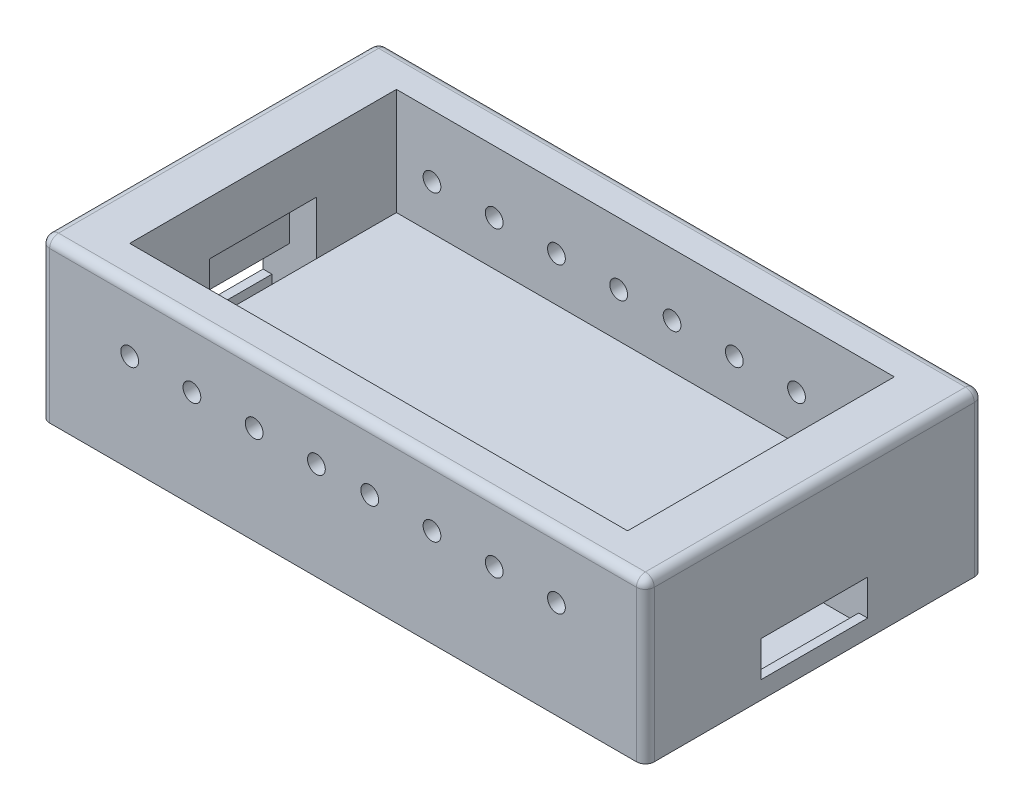
from build123d import *

# Parameters (mm, degrees)
SKETCH1_W               = 1727.2
SKETCH1_H               = 965.2
SKETCH1_W_2             = 1422.4
SKETCH1_H_2             = 762
BOSS_EXTRUDE1_DEPTH     = 457.2
SKETCH2_W               = 1422.4
SKETCH2_H               = 762
BOSS_EXTRUDE2_DEPTH     = 152.4
CUT_EXTRUDE1_DEPTH      = 1374.480192795
CUT_EXTRUDE1_DEPTH_BACK = 1374.480192795
SKETCH4_R               = 25.4
SKETCH7_W               = 304.8
SKETCH7_H               = 127
CUT_EXTRUDE2_DEPTH      = 127
SKETCH8_W               = 76.2
SKETCH8_H               = 304.8
CUT_EXTRUDE3_DEPTH      = 304.8
SKETCH9_W               = 25.4
SKETCH9_H               = 304.8
BOSS_EXTRUDE3_DEPTH     = 25.4
SKETCH11_W              = 304.8
SKETCH11_H              = 127
CUT_EXTRUDE5_DEPTH      = 127
SKETCH13_W              = 25.4
SKETCH13_H              = 304.8
BOSS_EXTRUDE4_DEPTH     = 25.4
SKETCH14_W              = 76.2
SKETCH14_H              = 304.8
CUT_EXTRUDE7_DEPTH      = 279.4
FILLET1_R               = 25.4
FILLET2_R               = 25.4


with BuildPart() as part:
    # Sketch1 → Boss-Extrude1 (new body)
    with BuildSketch(Plane(origin=(0, 0, 0), x_dir=(1, 0, 0), z_dir=(0, 1, 0))):
        Rectangle(SKETCH1_W, SKETCH1_H)
        Rectangle(SKETCH1_W_2, SKETCH1_H_2, mode=Mode.SUBTRACT)
    extrude(amount=BOSS_EXTRUDE1_DEPTH)

    # Sketch2 → Boss-Extrude2 (add)
    with BuildSketch(Plane(origin=(0, 0, 0), x_dir=(1, 0, 0), z_dir=(0, 1, 0))):
        Rectangle(SKETCH2_W, SKETCH2_H)
    extrude(amount=BOSS_EXTRUDE2_DEPTH)

    # Sketch4 → Cut-Extrude1 (cut, two sides: drawn at the far end of the back side and taken through both)
    with BuildSketch(Plane.XY.offset(482.6).offset(-CUT_EXTRUDE1_DEPTH_BACK)):
        with Locations((-609.6, 279.4)):
            Circle(SKETCH4_R)
        with Locations((-431.8, 279.4)):
            Circle(SKETCH4_R)
        with Locations((-254, 279.4)):
            Circle(SKETCH4_R)
        with Locations((-76.2, 279.4)):
            Circle(SKETCH4_R)
        with Locations((76.2, 279.4)):
            Circle(SKETCH4_R)
        with Locations((254, 279.4)):
            Circle(SKETCH4_R)
        with Locations((431.8, 279.4)):
            Circle(SKETCH4_R)
        with Locations((609.6, 279.4)):
            Circle(SKETCH4_R)
    extrude(amount=CUT_EXTRUDE1_DEPTH + CUT_EXTRUDE1_DEPTH_BACK, mode=Mode.SUBTRACT)

    # Sketch7 → Cut-Extrude2 (cut)
    with BuildSketch(Plane(origin=(863.6, 0, 0), x_dir=(0, 0, -1), z_dir=(1, 0, 0))):
        with Locations((0, 88.9)):
            Rectangle(SKETCH7_W, SKETCH7_H)
    extrude(amount=-CUT_EXTRUDE2_DEPTH, mode=Mode.SUBTRACT)

    # Sketch8 → Cut-Extrude3 (cut)
    with BuildSketch(Plane(origin=(0, 25.4, 0), x_dir=(1, 0, 0), z_dir=(0, 1, 0))):
        with Locations((749.3, 0)):
            Rectangle(SKETCH8_W, SKETCH8_H)
    extrude(amount=CUT_EXTRUDE3_DEPTH, mode=Mode.SUBTRACT)

    # Sketch9 → Boss-Extrude3 (add)
    with BuildSketch(Plane(origin=(0, 25.4, 0), x_dir=(1, 0, 0), z_dir=(0, 1, 0))):
        with Locations((850.9, 0)):
            Rectangle(SKETCH9_W, SKETCH9_H)
    extrude(amount=BOSS_EXTRUDE3_DEPTH)

    # Sketch11 → Cut-Extrude5 (cut)
    with BuildSketch(Plane.ZY.offset(863.6)):
        with Locations((0, 88.9)):
            Rectangle(SKETCH11_W, SKETCH11_H)
    extrude(amount=-CUT_EXTRUDE5_DEPTH, mode=Mode.SUBTRACT)

    # Sketch13 → Boss-Extrude4 (add)
    with BuildSketch(Plane(origin=(0, 25.4, 0), x_dir=(1, 0, 0), z_dir=(0, 1, 0))):
        with Locations((-850.9, 0)):
            Rectangle(SKETCH13_W, SKETCH13_H)
    extrude(amount=BOSS_EXTRUDE4_DEPTH)

    # Sketch14 → Cut-Extrude7 (cut)
    with BuildSketch(Plane(origin=(0, 25.4, 0), x_dir=(1, 0, 0), z_dir=(0, 1, 0))):
        with Locations((-749.3, 0)):
            Rectangle(SKETCH14_W, SKETCH14_H)
    extrude(amount=CUT_EXTRUDE7_DEPTH, mode=Mode.SUBTRACT)

    # Fillet1
    fillet1_edges = [part.edges().sort_by_distance(p)[0] for p in [
        (863.6, 457.2, 0),
        (0, 457.2, -482.6),
        (-863.6, 457.2, 0),
        (0, 457.2, 482.6),
    ]]
    fillet(fillet1_edges, radius=FILLET1_R)

    # Fillet2
    # the kernel refuses this fillet: 25.4 mm, written as the material it takes off along each edge
    with BuildSketch(Plane(origin=(-838.2, 431.8, 457.2), x_dir=(0, 0, 1), z_dir=(-1, 0, 0))) as fillet2_piece_1_section:
        Polygon((0, 0), (FILLET2_R * 1.02, 0), (FILLET2_R * 1.02, FILLET2_R * 1.02), (0, FILLET2_R * 1.02), align=None)
    fillet2_piece_1 = extrude(amount=FILLET2_R * 1.02, mode=Mode.PRIVATE)
    fillet2_piece_1 = fillet2_piece_1 - Plane(origin=(-838.2, 431.8, 457.2), x_dir=(0, -0.7071067811865475, -0.7071067811865475), z_dir=(-1, 0, 0)) * Sphere(FILLET2_R, mode=Mode.PRIVATE)
    add(fillet2_piece_1, mode=Mode.SUBTRACT)
    with BuildSketch(Plane(origin=(-838.2, 431.8, -457.2), x_dir=(-1, 0, 0), z_dir=(0, 0, -1))) as fillet2_piece_2_section:
        Polygon((0, 0), (FILLET2_R * 1.02, 0), (FILLET2_R * 1.02, FILLET2_R * 1.02), (0, FILLET2_R * 1.02), align=None)
    fillet2_piece_2 = extrude(amount=FILLET2_R * 1.02, mode=Mode.PRIVATE)
    fillet2_piece_2 = fillet2_piece_2 - Plane(origin=(-838.2, 431.8, -457.2), x_dir=(0.7071067811865475, -0.7071067811865475, 0), z_dir=(0, 0, -1)) * Sphere(FILLET2_R, mode=Mode.PRIVATE)
    add(fillet2_piece_2, mode=Mode.SUBTRACT)
    with BuildSketch(Plane(origin=(838.2, 431.8, 457.2), x_dir=(0, 0, 1), z_dir=(1, 0, 0))) as fillet2_piece_3_section:
        Polygon((0, 0), (FILLET2_R * 1.02, 0), (FILLET2_R * 1.02, -FILLET2_R * 1.02), (0, -FILLET2_R * 1.02), align=None)
    fillet2_piece_3 = extrude(amount=FILLET2_R * 1.02, mode=Mode.PRIVATE)
    fillet2_piece_3 = fillet2_piece_3 - Plane(origin=(838.2, 431.8, 457.2), x_dir=(0, -0.7071067811865475, -0.7071067811865475), z_dir=(1, 0, 0)) * Sphere(FILLET2_R, mode=Mode.PRIVATE)
    add(fillet2_piece_3, mode=Mode.SUBTRACT)
    with BuildSketch(Plane(origin=(838.2, 431.8, -457.2), x_dir=(1, 0, 0), z_dir=(0, 0, -1))) as fillet2_piece_4_section:
        Polygon((0, 0), (FILLET2_R * 1.02, 0), (FILLET2_R * 1.02, -FILLET2_R * 1.02), (0, -FILLET2_R * 1.02), align=None)
    fillet2_piece_4 = extrude(amount=FILLET2_R * 1.02, mode=Mode.PRIVATE)
    fillet2_piece_4 = fillet2_piece_4 - Plane(origin=(838.2, 431.8, -457.2), x_dir=(-0.7071067811865475, -0.7071067811865475, 0), z_dir=(0, 0, -1)) * Sphere(FILLET2_R, mode=Mode.PRIVATE)
    add(fillet2_piece_4, mode=Mode.SUBTRACT)
    with BuildSketch(Plane(origin=(863.6, -63.5, -482.6), x_dir=(-1, 0, 0), z_dir=(0, 1, 0)), Plane(origin=(863.6, -63.5, 482.6), x_dir=(0, 0, -1), z_dir=(0, 1, 0))) as fillet2_piece_5:
        with BuildLine():
            CenterArc((FILLET2_R, FILLET2_R), FILLET2_R, 180, 90)
            Line((0, FILLET2_R), (0, 0))
            Line((0, 0), (FILLET2_R, 0))
        make_face()
    extrude(amount=495.3, mode=Mode.SUBTRACT)
    with BuildSketch(Plane(origin=(-863.6, -63.5, -482.6), x_dir=(1, 0, 0), z_dir=(0, 1, 0)), Plane(origin=(-863.6, -63.5, 482.6), x_dir=(0, 0, -1), z_dir=(0, 1, 0))) as fillet2_piece_6:
        with BuildLine():
            CenterArc((FILLET2_R, -FILLET2_R), FILLET2_R, 90, 90)
            Line((0, -FILLET2_R), (0, 0))
            Line((0, 0), (FILLET2_R, 0))
        make_face()
    extrude(amount=495.3, mode=Mode.SUBTRACT)


solid = part.part
